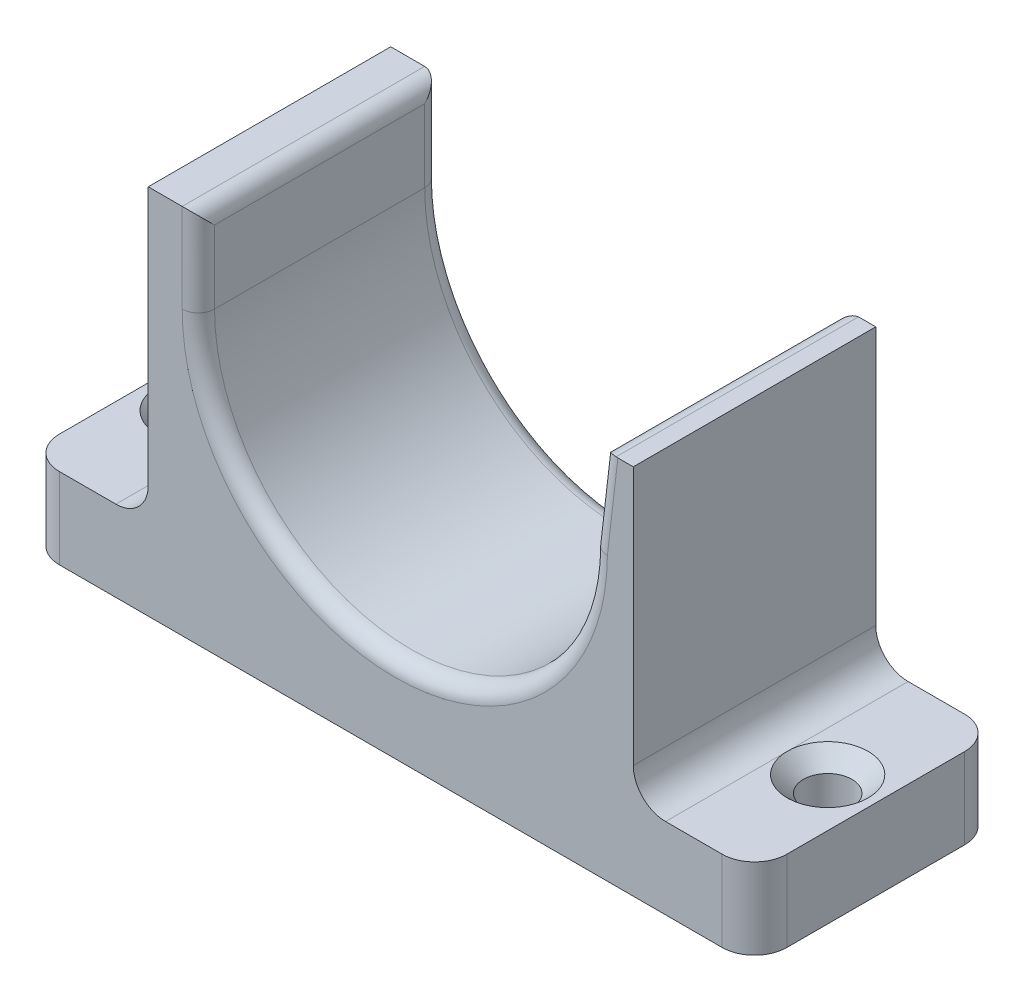
from build123d import *

# Parameters (mm, degrees)
SKETCH1_W           = 45
SKETCH1_H           = 15
BOSS_EXTRUDE1_DEPTH = 5
SKETCH2_W           = 30
SKETCH2_H           = 15
BOSS_EXTRUDE2_DEPTH = 18
FILLET1_R           = 2
SKETCH3_R           = 1.5
CUT_EXTRUDE1_DEPTH  = 20
CHAMFER1_SIZE       = 1
CUT_EXTRUDE2_DEPTH  = 20
CUT_EXTRUDE3_DEPTH  = 20
FILLET2_R           = 1


with BuildPart() as part:
    # Sketch1 → Boss-Extrude1 (new body)
    with BuildSketch(Plane(origin=(0, 0, 0), x_dir=(1, 0, 0), z_dir=(0, 1, 0))):
        with Locations((22.5, 7.5)):
            Rectangle(SKETCH1_W, SKETCH1_H)
    extrude(amount=BOSS_EXTRUDE1_DEPTH)

    # Sketch2 → Boss-Extrude2 (add)
    with BuildSketch(Plane(origin=(0, 5, 0), x_dir=(1, 0, 0), z_dir=(0, 1, 0))):
        with Locations((22.5, 7.5)):
            Rectangle(SKETCH2_W, SKETCH2_H)
    extrude(amount=BOSS_EXTRUDE2_DEPTH)

    # Fillet1
    fillet1_edges = [part.edges().sort_by_distance(p)[0] for p in [
        (7.5, 5, -7.5),
        (37.5, 5, -7.5),
        (0, 2.5, 0),
        (0, 2.5, -15),
        (45, 2.5, -15),
        (45, 2.5, 0),
    ]]
    fillet(fillet1_edges, radius=FILLET1_R)

    # Sketch3 → Cut-Extrude1 (cut)
    with BuildSketch(Plane(origin=(0, 5, 0), x_dir=(1, 0, 0), z_dir=(0, 1, 0))):
        with Locations(Location((3, 7.524826623, 0), (0, 0, 270))):
            Circle(SKETCH3_R)
        with Locations(Location((42, 7.524826623, 0), (0, 0, 270))):
            Circle(SKETCH3_R)
    extrude(amount=-CUT_EXTRUDE1_DEPTH, mode=Mode.SUBTRACT)

    # Chamfer1
    chamfer1_edges = [part.edges().sort_by_distance(p)[0] for p in [
        (3, 5, -9.024826623),
        (42, 5, -9.024826623),
    ]]
    chamfer(chamfer1_edges, length=CHAMFER1_SIZE - 0.0001)  # a hair under: the kernel refuses the full size

    # Sketch4 → Cut-Extrude2 (cut)
    with BuildSketch(Plane.XY):
        with BuildLine():
            Line((11.916858064, 23), (33.584575987, 23))
            ThreePointArc((33.584575987, 23), (22.750717026, 5.35), (11.916858064, 23))
        make_face()
    extrude(amount=-CUT_EXTRUDE2_DEPTH, mode=Mode.SUBTRACT)

    # Sketch6 → Cut-Extrude3 (cut)
    with BuildSketch(Plane.XY):
        with BuildLine():
            ThreePointArc((33.584575987, 23), (34.567101549, 20.327641563), (34.900717026, 17.5))
            Line((34.900717026, 17.5), (35.542287994, 23))
            Line((35.542287994, 23), (33.584575987, 23))
        make_face()
        with BuildLine():
            Line((10.600717026, 23), (10.600717026, 17.5))
            ThreePointArc((10.600717026, 17.5), (10.934332503, 20.327641563), (11.916858064, 23))
            Line((11.916858064, 23), (10.600717026, 23))
        make_face()
    extrude(amount=-CUT_EXTRUDE3_DEPTH, mode=Mode.SUBTRACT)

    # Fillet2
    fillet2_edges = [part.edges().sort_by_distance(p)[0] for p in [
        (22.750717026, 5.35, 0),
        (22.750717026, 5.35, -15),
        (35.22150251, 20.25, -15),
        (35.542287994, 23, -7.5),
        (35.22150251, 20.25, 0),
        (10.600717026, 23, -7.5),
        (10.600717026, 20.25, -15),
        (10.600717026, 20.25, 0),
    ]]
    fillet(fillet2_edges, radius=FILLET2_R)


solid = part.part
